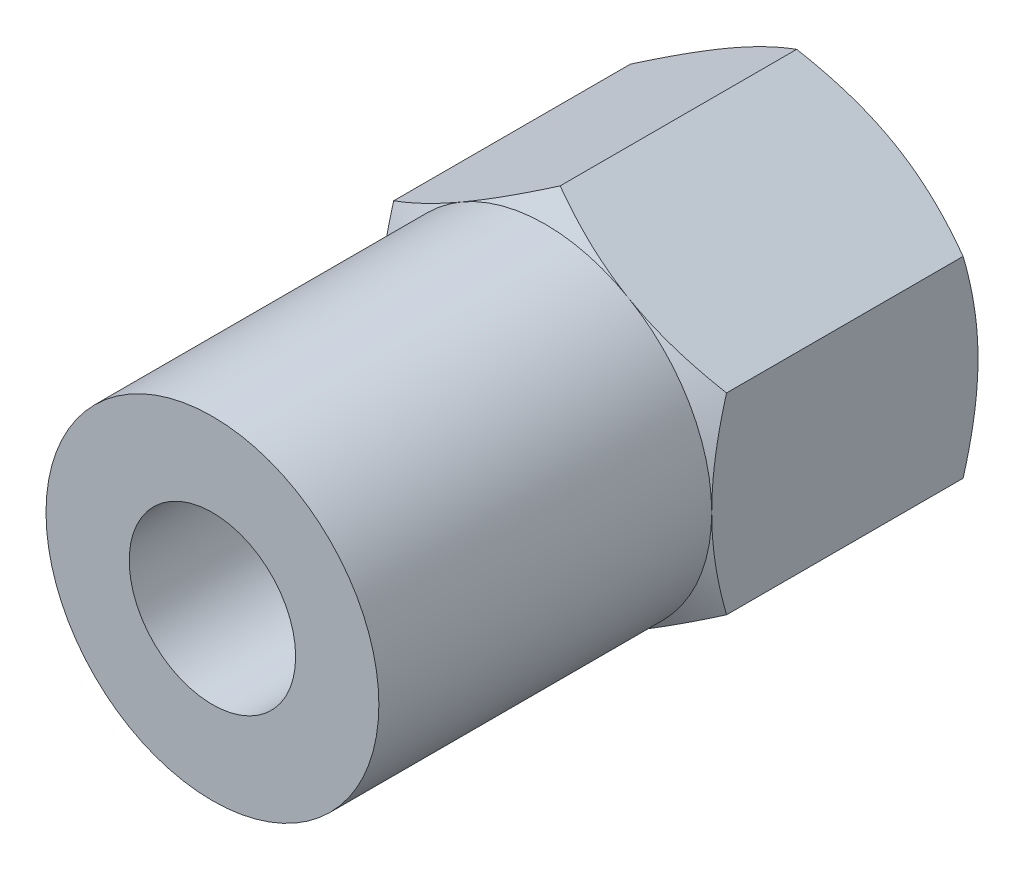
from build123d import *
from build123d.topology import SkipClean

# Parameters (mm, degrees)
BOSS_EXTRUDE1_DEPTH       = 4
M3X0_5_TAPPED_HOLE1_D     = 2.5
M3X0_5_TAPPED_HOLE1_DEPTH = 7.5
M3X0_5_TAPPED_HOLE1_TIP   = 0.751075774
SKETCH5_R                 = 1.25
BOSS_EXTRUDE2_DEPTH       = 5


with BuildPart() as part:
    # Sketch1 → Boss-Extrude1 (new body)
    with BuildSketch(Plane.XY):
        Polygon((0, 2.886751346), (-2.5, 1.443375673), (-2.5, -1.443375673), (0, -2.886751346), (2.5, -1.443375673), (2.5, 1.443375673), align=None)
    extrude(amount=BOSS_EXTRUDE1_DEPTH)

    # M3x0.5 Tapped Hole1
    with Locations(Plane.XY.offset(4)):
        with Locations((0, 0)):
            Hole(M3X0_5_TAPPED_HOLE1_D / 2, depth=M3X0_5_TAPPED_HOLE1_DEPTH)
            with Locations((0, 0, -(M3X0_5_TAPPED_HOLE1_DEPTH + M3X0_5_TAPPED_HOLE1_TIP / 2))):  # 118° drill point
                Cone(0, M3X0_5_TAPPED_HOLE1_D / 2, M3X0_5_TAPPED_HOLE1_TIP, mode=Mode.SUBTRACT)

    # Sketch4 → Cut-Revolve1 (revolve, cut)
    with BuildSketch(Plane(origin=(0, 0, 0), x_dir=(0, 0, -1), z_dir=(1, 0, 0))):
        Polygon((-3.776709006, 2.886751346), (-4, 2.5), (-4, 2.886751346), align=None)
        Polygon((0, 2.886751346), (-0.223290994, 2.886751346), (0, 2.5), align=None)
    revolve(axis=Axis((0, 0, 0), (0, 0, 1)), mode=Mode.SUBTRACT)

    # Sketch5 → Boss-Extrude2 (add)
    with SkipClean():  # the faces are left unmerged after this step: merging them gives an invalid solid
        with BuildSketch(Plane.XY.offset(4)):
            with BuildLine():
                ThreePointArc((1.25, -2.165063509), (2.165063509, -1.25), (2.5, 0))
                ThreePointArc((2.5, 0), (2.165063509, 1.25), (1.25, 2.165063509))
                ThreePointArc((1.25, 2.165063509), (0, 2.5), (-1.25, 2.165063509))
                ThreePointArc((-1.25, 2.165063509), (-2.165063509, 1.25), (-2.5, 0))
                ThreePointArc((-2.5, 0), (-2.165063509, -1.25), (-1.25, -2.165063509))
                ThreePointArc((-1.25, -2.165063509), (0, -2.5), (1.25, -2.165063509))
            make_face()
            Circle(SKETCH5_R, mode=Mode.SUBTRACT)
        extrude(amount=BOSS_EXTRUDE2_DEPTH)
    add(part.part.scale(1), mode=Mode.REPLACE)  # the faces are merged on a copy


solid = part.part
